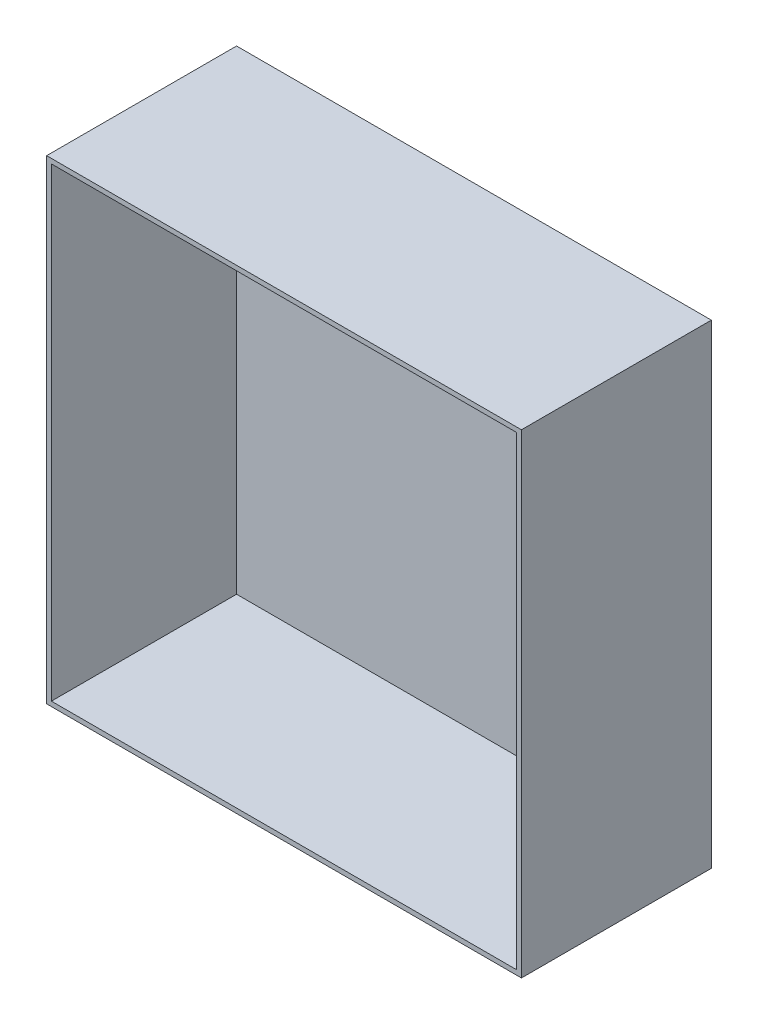
from build123d import *

# Parameters (mm, degrees)
SKETCH1_W           = 254
SKETCH1_H           = 101.6
BOSS_EXTRUDE1_DEPTH = 127
SHELL1_T            = -2.54


with BuildPart() as part:
    # Sketch1 → Boss-Extrude1 (new, symmetric)
    with BuildSketch(Plane(origin=(0, 0, 0), x_dir=(1, 0, 0), z_dir=(0, 1, 0))):
        Rectangle(SKETCH1_W, SKETCH1_H)
    extrude(amount=BOSS_EXTRUDE1_DEPTH, both=True)

    # Shell1
    shell1_openings = [part.faces().sort_by_distance(p)[0] for p in [
        (0, 0, 50.8),
    ]]
    offset(amount=SHELL1_T, openings=shell1_openings, kind=Kind.INTERSECTION)


solid = part.part
